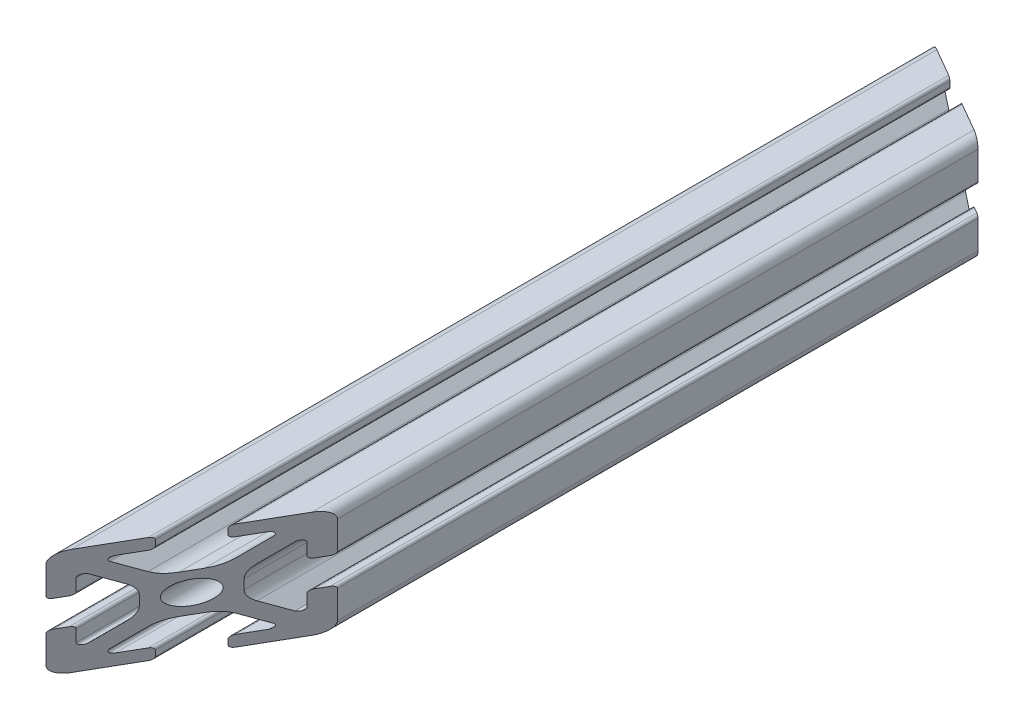
from build123d import *

# Parameters (mm, degrees)
BOSS_EXTRUDE1_DEPTH = 100
SKETCH5_OUTSIDE_W   = 62.398
SKETCH5_OUTSIDE_H   = 242.398
CUT_EXTRUDE1_DEPTH  = 103.46950766


with BuildPart() as part:
    # Sketch4 → Boss-Extrude1 (new, symmetric)
    with BuildSketch(Plane.XY):
        with BuildLine():
            Line((3, -10), (8.25, -10))
            ThreePointArc((8.25, -10), (9.487436867, -9.487436867), (10, -8.25))
            Line((10, -8.25), (10, -3))
            ThreePointArc((10, -3), (9.853553391, -2.646446609), (9.5, -2.5))
            Line((9.5, -2.5), (8.424621202, -2.5))
            ThreePointArc((8.424621202, -2.5), (8.071067812, -2.646446609), (7.924621202, -3))
            Line((7.924621202, -3), (7.924621202, -5.25))
            ThreePointArc((7.924621202, -5.25), (7.615962919, -5.711939766), (7.071067812, -5.603553391))
            Line((7.071067812, -5.603553391), (4.478679656, -3.011165235))
            ThreePointArc((4.478679656, -3.011165235), (3.828361402, -2.037895189), (3.6, -0.889844892))
            Line((3.6, -0.889844892), (3.6, 0))
            Line((3.6, 0), (2.15, 0))
            ThreePointArc((2.15, 0), (1.52027958, -1.52027958), (0, -2.15))
            Line((0, -2.15), (0, -3.6))
            Line((0, -3.6), (0.889844892, -3.6))
            ThreePointArc((0.889844892, -3.6), (2.037895189, -3.828361402), (3.011165235, -4.478679656))
            Line((3.011165235, -4.478679656), (5.603553391, -7.071067812))
            ThreePointArc((5.603553391, -7.071067812), (5.711939766, -7.615962919), (5.25, -7.924621202))
            Line((5.25, -7.924621202), (3, -7.924621202))
            ThreePointArc((3, -7.924621202), (2.646446609, -8.071067812), (2.5, -8.424621202))
            Line((2.5, -8.424621202), (2.5, -9.5))
            ThreePointArc((2.5, -9.5), (2.646446609, -9.853553391), (3, -10))
        make_face()
    extrude(amount=BOSS_EXTRUDE1_DEPTH, both=True)

    # Mirror1: part across plane


with BuildPart() as part_1:
    add(part.part)
    add(part.part.mirror(Plane(origin=(0, 0, 0), x_dir=(0, 0, 1), z_dir=(1, 0, 0))))

    # Mirror2: part across plane


with BuildPart() as part_2:
    add(part_1.part)
    add(part_1.part.mirror(Plane.ZX))

    # Sketch5 outside → Cut-Extrude1 (cut, through all)
    with BuildSketch(Plane(origin=(0, 10, 0), x_dir=(1, 0, 0), z_dir=(0, 1, 0))):
        Rectangle(SKETCH5_OUTSIDE_W, SKETCH5_OUTSIDE_H)
        Polygon((-10, -100), (62, 24.707658145), (-11.612159322, 67.207658145), align=None, mode=Mode.SUBTRACT)
    extrude(amount=-CUT_EXTRUDE1_DEPTH, mode=Mode.SUBTRACT)


solid = part_2.part
